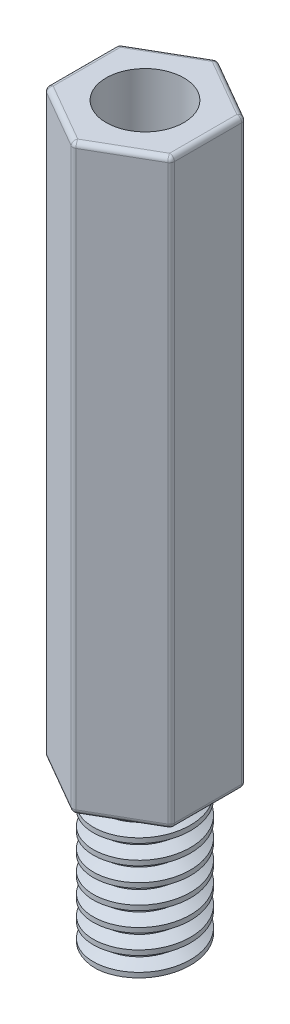
from build123d import *

# Parameters (mm, degrees)
EXTRUDE_1_DEPTH        = 15
HOLE_WIZARD_M2_1_D     = 1.6
HOLE_WIZARD_M2_1_DEPTH = 3.5
HOLE_WIZARD_M2_1_TIP   = 0.480688495
SKETCH_6_R             = 1.943488468
SKETCH_6_R_2           = 1
CUT_EXTRUDE_1_DEPTH    = 3
THREAD_1_PITCH         = 0.4
FILLET_1_R             = 0.1


with BuildPart() as part:
    # 草图1 → 凸台-拉伸1 (new body)
    with BuildSketch(Plane(origin=(0, 0, 0), x_dir=(1, 0, 0), z_dir=(0, 1, 0))):
        Polygon((-1.299038106, 0.75), (0, 1.5), (1.299038106, 0.75), (1.299038106, -0.75), (0, -1.5), (-1.299038106, -0.75), align=None)
    extrude(amount=EXTRUDE_1_DEPTH)

    # M2 螺纹孔1
    with Locations(Plane(origin=(0, 15, 0), x_dir=(1, 0, 0), z_dir=(0, 1, 0))):
        with Locations((0, 0)):
            Hole(HOLE_WIZARD_M2_1_D / 2, depth=HOLE_WIZARD_M2_1_DEPTH)
            with Locations((0, 0, -(HOLE_WIZARD_M2_1_DEPTH + HOLE_WIZARD_M2_1_TIP / 2))):  # 118° drill point
                Cone(0, HOLE_WIZARD_M2_1_D / 2, HOLE_WIZARD_M2_1_TIP, mode=Mode.SUBTRACT)

    # 草图6 → 切除-拉伸1 (cut)
    with BuildSketch(Plane.XZ):
        Circle(SKETCH_6_R)
        with Locations(Location((0, 0, 0), (0, 0, 270))):
            Circle(SKETCH_6_R_2, mode=Mode.SUBTRACT)
    extrude(amount=-CUT_EXTRUDE_1_DEPTH, mode=Mode.SUBTRACT)

    # 螺纹线1: the profile of Sketch 2 profile screwed along a right-hand helix of 9.5 turns, 6 arcs to a turn; built about Z, then put on its axis
    thread_1_z = Axis((0, 0, 0), (0, 0, 1))
    thread_1_corners = [(1.0003, 0, 0.300173206), (0.783493648, 0, 0.175000001), (0.783493648, 0, 0.125000001), (1.0003, 0, -0.000173205)]
    with BuildLine(mode=Mode.PRIVATE) as thread_1_profile:
        Line(thread_1_corners[0], thread_1_corners[1])
        Line(thread_1_corners[1], thread_1_corners[2])
        Line(thread_1_corners[2], thread_1_corners[3])
        Line(thread_1_corners[3], thread_1_corners[0])
    thread_1_cap = Face(thread_1_profile.wire())
    thread_1_turn_angles = [0, 30, 60, 90, 120, 150, 180, 210, 240, 270, 300, 330, 360]
    thread_1_turn_weights = [1, 0.8660254037844387, 1, 0.8660254037844387, 1, 0.8660254037844387, 1, 0.8660254037844387, 1, 0.8660254037844387, 1, 0.8660254037844387, 1]
    thread_1_turn_rails = [Edge.make_bspline([Vector(p[0], p[1], 0).rotate(thread_1_z, thread_1_turn_angles[k]) / thread_1_turn_weights[k] + Vector(0, 0, p[2] + THREAD_1_PITCH * thread_1_turn_angles[k] / 360) for k in range(13)], [0, 0, 0, 1, 1, 2, 2, 3, 3, 4, 4, 5, 5, 6, 6, 6], 2, thread_1_turn_weights) for p in thread_1_corners]
    thread_1_turn_sides = [Face.make_surface_from_curves(thread_1_turn_rails[p[0]], thread_1_turn_rails[p[1]]) for p in [(0, 1), (1, 2), (2, 3), (3, 0)]]
    thread_1_last_angles = [3240, 3270, 3300, 3330, 3360, 3390, 3420]
    thread_1_last_weights = [1, 0.8660254037844387, 1, 0.8660254037844387, 1, 0.8660254037844387, 1]
    thread_1_last_rails = [Edge.make_bspline([Vector(p[0], p[1], 0).rotate(thread_1_z, thread_1_last_angles[k]) / thread_1_last_weights[k] + Vector(0, 0, p[2] + THREAD_1_PITCH * thread_1_last_angles[k] / 360) for k in range(7)], [0, 0, 0, 1, 1, 2, 2, 3, 3, 3], 2, thread_1_last_weights) for p in thread_1_corners]
    thread_1_last_sides = [Face.make_surface_from_curves(thread_1_last_rails[p[0]], thread_1_last_rails[p[1]]) for p in [(0, 1), (1, 2), (2, 3), (3, 0)]]
    thread_1 = Plane(origin=(0, -1, 0), x_dir=(1, 0, 0), z_dir=(0, 1, 0)) * Solid(Shell([*[p.moved(Location((0, 0, THREAD_1_PITCH * i))) for i in range(9) for p in thread_1_turn_sides], *thread_1_last_sides, thread_1_cap, thread_1_cap.rotate(thread_1_z, 3420).moved(Location((0, 0, THREAD_1_PITCH * 3420 / 360)))]))
    add(thread_1, mode=Mode.SUBTRACT)

    # 圆角1
    fillet_1_edges = [part.edges().sort_by_distance(p)[0] for p in [
        (0.649519053, 15, -1.125),
        (0, 9, 1.5),
        (-1.299038106, 9, 0.75),
        (-1.299038106, 9, -0.75),
        (0, 9, -1.5),
        (1.299038106, 9, -0.75),
        (1.299038106, 9, 0.75),
        (-0.649519053, 15, -1.125),
        (-1.299038106, 15, 0),
        (-0.649519053, 15, 1.125),
        (-0.649519053, 3, 1.125),
        (1.299038106, 3, 0),
        (0.649519053, 3, 1.125),
        (-1.299038106, 3, 0),
        (-0.649519053, 3, -1.125),
        (0.649519053, 3, -1.125),
        (0.649519053, 15, 1.125),
        (1.299038106, 15, 0),
    ]]
    fillet(fillet_1_edges, radius=FILLET_1_R)


solid = part.part
